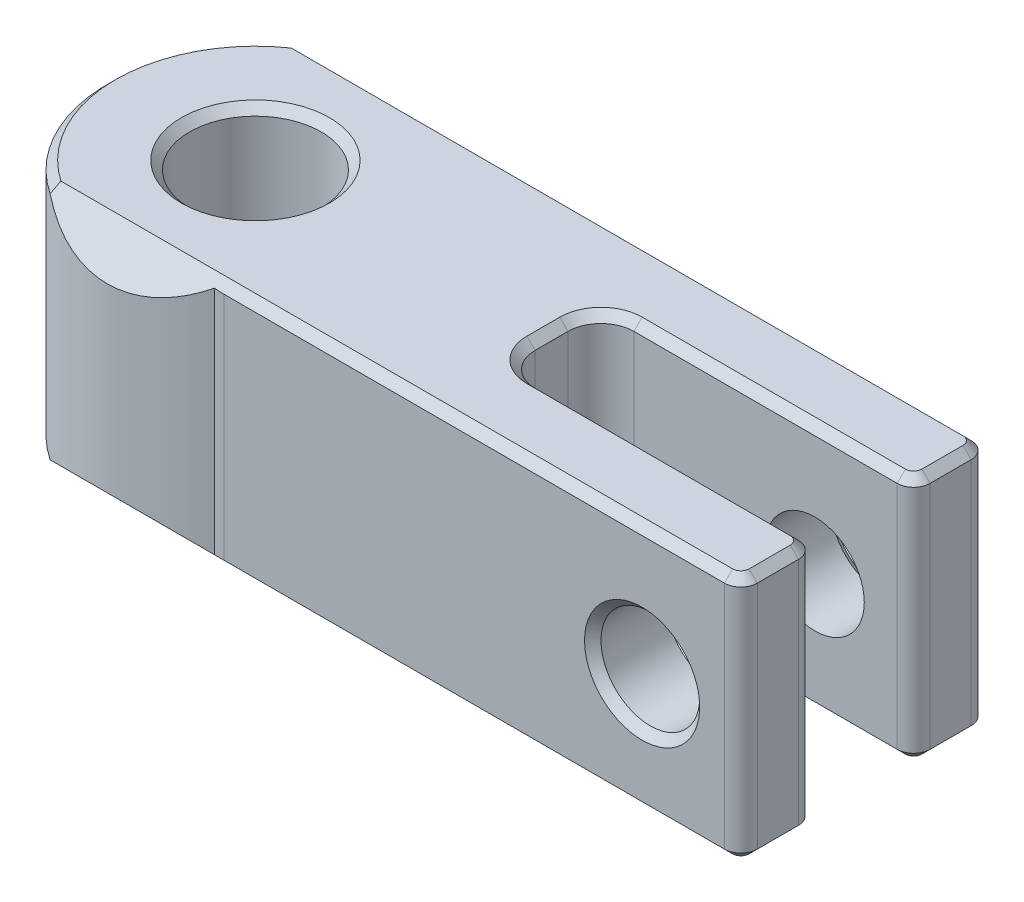
from build123d import *

# Parameters (mm, degrees)
SKETCH1_R           = 9
SKETCH1_R_2         = 4
BOSS_EXTRUDE1_DEPTH = 7.5
SKETCH2_W           = 32
SKETCH2_H           = 15
BOSS_EXTRUDE2_DEPTH = 7.5
SKETCH3_W           = 38
SKETCH3_H           = 6
CUT_EXTRUDE1_DEPTH  = 19
SKETCH4_R           = 3
CUT_EXTRUDE2_DEPTH  = 22
FILLET1_R           = 2
FILLET2_R           = 1
CHAMFER1_SIZE       = 0.5
CHAMFER2_SIZE       = 0.5
CHAMFER3_SIZE       = 0.5
FILLET3_R           = 10


with BuildPart() as part:
    # Sketch1 → Boss-Extrude1 (new, symmetric)
    with BuildSketch(Plane(origin=(0, 0, 0), x_dir=(1, 0, 0), z_dir=(0, 1, 0))):
        with Locations(Location((0, 0, 0), (0, 0, 270))):
            Circle(SKETCH1_R)
        with Locations(Location((0, 0, 0), (0, 0, 270))):
            Circle(SKETCH1_R_2, mode=Mode.SUBTRACT)
    extrude(amount=BOSS_EXTRUDE1_DEPTH, both=True)

    # Sketch2 → Boss-Extrude2 (add, symmetric)
    with BuildSketch(Plane(origin=(0, 0, 0), x_dir=(1, 0, 0), z_dir=(0, 1, 0))):
        with Locations((21, 0)):
            Rectangle(SKETCH2_W, SKETCH2_H)
    extrude(amount=BOSS_EXTRUDE2_DEPTH, both=True)

    # Sketch3 → Cut-Extrude1 (cut, symmetric)
    with BuildSketch(Plane(origin=(0, 0, 0), x_dir=(1, 0, 0), z_dir=(0, 1, 0))):
        with Locations((37, 0)):
            Rectangle(SKETCH3_W, SKETCH3_H)
    extrude(amount=CUT_EXTRUDE1_DEPTH, both=True, mode=Mode.SUBTRACT)

    # Sketch4 → Cut-Extrude2 (cut, symmetric)
    with BuildSketch(Plane.XY.offset(-3)):
        with Locations((31, -0.267092661)):
            Circle(SKETCH4_R)
    extrude(amount=CUT_EXTRUDE2_DEPTH, both=True, mode=Mode.SUBTRACT)

    # Fillet1
    fillet1_edges = [part.edges().sort_by_distance(p)[0] for p in [
        (18, 0, 3),
        (18, 0, -3),
    ]]
    fillet(fillet1_edges, radius=FILLET1_R)

    # Fillet2
    fillet2_edges = [part.edges().sort_by_distance(p)[0] for p in [
        (37, 0, 7.5),
        (37, 0, -7.5),
        (37, 0, -3),
        (37, 0, 3),
    ]]
    fillet(fillet2_edges, radius=FILLET2_R)

    # Chamfer1
    chamfer1_edges = [part.edges().sort_by_distance(p)[0] for p in [
        (28, -0.267092661, 7.5),
        (28, -0.267092661, -7.5),
        (0, -7.5, -4),
        (0, 7.5, -4),
    ]]
    chamfer(chamfer1_edges, length=CHAMFER1_SIZE)

    # Chamfer2
    chamfer2_edges = [part.edges().sort_by_distance(p)[0] for p in [
        (20.5, 7.5, -7.5),
        (20.5, -7.5, -7.5),
        (36.707106781, -7.5, -7.207106781),
        (37, -7.5, -5.25),
        (37, 7.5, -5.25),
        (36.707106781, -7.5, -3.292893219),
        (28, -7.5, -3),
        (18.585786438, -7.5, -2.414213562),
        (18, -7.5, 0),
        (18.585786438, -7.5, 2.414213562),
        (28, -7.5, 3),
        (36.707106781, -7.5, 3.292893219),
        (37, -7.5, 5.25),
        (37, 7.5, 5.25),
        (36.707106781, -7.5, 7.207106781),
        (20.5, -7.5, 7.5),
        (20.5, 7.5, 7.5),
        (36.707106781, 7.5, -7.207106781),
        (36.707106781, 7.5, -3.292893219),
        (28, 7.5, -3),
        (18.585786438, 7.5, -2.414213562),
        (18, 7.5, 0),
        (18.585786438, 7.5, 2.414213562),
        (28, 7.5, 3),
        (36.707106781, 7.5, 3.292893219),
        (36.707106781, 7.5, 7.207106781),
    ]]
    chamfer(chamfer2_edges, length=CHAMFER2_SIZE)

    # Chamfer3
    chamfer3_edges = [part.edges().sort_by_distance(p)[0] for p in [
        (-9, 7.5, 0),
        (-9, -7.5, 0),
    ]]
    chamfer(chamfer3_edges, length=CHAMFER3_SIZE)

    # Fillet3
    # the kernel refuses this fillet: 10 mm, written as the material it takes off along each edge
    with BuildSketch(Plane(origin=(5, 8.443576575, -7.5), x_dir=(0, 0, 1), z_dir=(0, -1, 0))) as fillet3_piece_1:
        with BuildLine():
            CenterArc((10, -0.57743063), FILLET3_R, 176.6897249, 3.3102751)
            Line((0, -0.57743063), (0, 0))
            Line((0, 0), (0.016685226, 0))
        make_face()
    extrude(amount=16.887153149, mode=Mode.SUBTRACT)
    with BuildSketch(Plane(origin=(5, 8.443576575, 7.5), x_dir=(0, 0, -1), z_dir=(0, -1, 0))) as fillet3_piece_2:
        with BuildLine():
            CenterArc((10, 0.57743063), FILLET3_R, 180, 3.3102751)
            Line((0, 0.57743063), (0, 0))
            Line((0, 0), (0.016685226, 0))
        make_face()
    extrude(amount=16.887153149, mode=Mode.SUBTRACT)


solid = part.part
